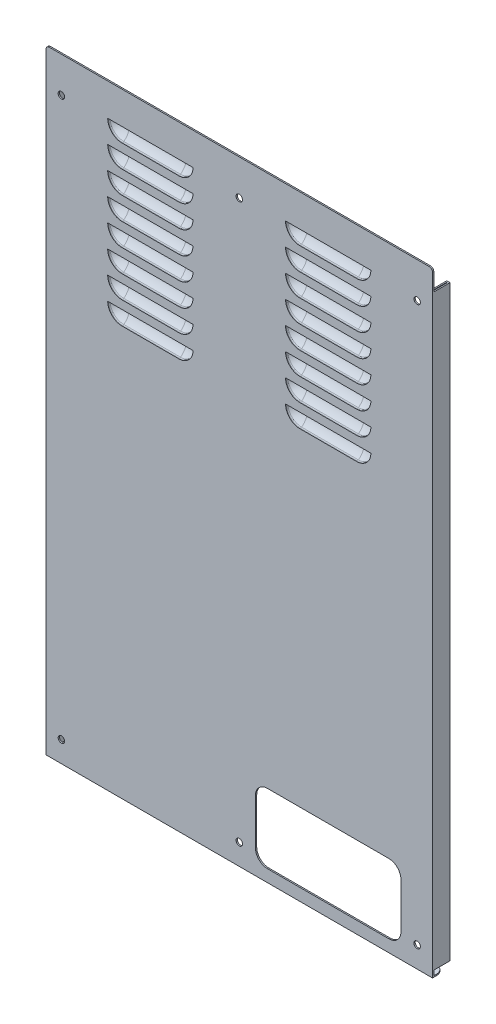
from build123d import *

# Parameters (mm, degrees)
SKETCH1_W              = 303.53
SKETCH1_H              = 482.6
BOSS_EXTRUDE1_DEPTH    = 1.016
FILLET1_R              = 2.54
SKETCH3_W              = 303.53
SKETCH3_H              = 9.525
BOSS_EXTRUDE3_DEPTH    = 1.016
FILLET2_R              = 6.35
CUT_EXTRUDE2_DEPTH     = 5.08
BOSS_EXTRUDE4_DEPTH    = 6.096
FILLET4_R              = 12.3952
SHELL1_START           = 47.544181529
SHELL1_DEPTH           = 44.591316942
SHELL1_2_ANGLE         = 90
SHELL1_3_ANGLE         = 90
CUT_EXTRUDE4_DEPTH     = 6.096
LPATTERN1_COUNT        = 8
LPATTERN1_PITCH        = 17.78
LPATTERN1_COPY_1_DEPTH = 6.096
LPATTERN1_COPY_2_DEPTH = 6.096
LPATTERN1_COPY_3_DEPTH = 6.096
LPATTERN1_COPY_4_DEPTH = 6.096
LPATTERN1_COPY_5_DEPTH = 6.096
LPATTERN1_COPY_6_DEPTH = 6.096
LPATTERN1_COPY_7_DEPTH = 6.096
LPATTERN2_COUNT        = 8
LPATTERN2_PITCH        = 17.78
FILLET5_R              = 1.524
SKETCH11_W             = 12.7
SKETCH11_H             = 461.264
BOSS_EXTRUDE5_DEPTH    = 1.016
SKETCH12_W             = 12.7
SKETCH12_H             = 461.264
BOSS_EXTRUDE6_DEPTH    = 1.016
SKETCH13_R             = 2.54
CUT_EXTRUDE5_DEPTH     = 2.54
SKETCH15_W             = 1.016
SKETCH15_H             = 461.264
BOSS_EXTRUDE7_DEPTH    = 1.524
SKETCH16_W             = 1.016
SKETCH16_H             = 461.264
BOSS_EXTRUDE8_DEPTH    = 11.303


with BuildPart() as part:
    # Sketch1 → Boss-Extrude1 (new body)
    with BuildSketch(Plane.XY):
        Rectangle(SKETCH1_W, SKETCH1_H)
    extrude(amount=BOSS_EXTRUDE1_DEPTH)

    # Fillet1
    fillet1_edges = [part.edges().sort_by_distance(p)[0] for p in [
        (-151.765, 241.3, 0.508),
        (151.765, 241.3, 0.508),
    ]]
    fillet(fillet1_edges, radius=FILLET1_R)

    # Sketch3 → Boss-Extrude3 (add)
    with BuildSketch(Plane.XZ.offset(241.3)):
        with Locations((0, -3.7465)):
            Rectangle(SKETCH3_W, SKETCH3_H)
    extrude(amount=-BOSS_EXTRUDE3_DEPTH)

    # Fillet2
    fillet2_edges = [part.edges().sort_by_distance(p)[0] for p in [
        (-151.765, -240.792, -8.509),
        (151.765, -240.792, -8.509),
    ]]
    fillet(fillet2_edges, radius=FILLET2_R)

    # Sketch6 → Cut-Extrude2 (cut)
    with BuildSketch(Plane.XY.offset(1.016)):
        with BuildLine():
            Line((22.225, -177.165), (117.45468, -177.165))
            ThreePointArc((117.45468, -177.165), (124.189872091, -179.954807909), (126.97968, -186.69))
            Line((126.97968, -186.69), (126.97968, -222.25))
            ThreePointArc((126.97968, -222.25), (124.189872091, -228.985192091), (117.45468, -231.775))
            Line((117.45468, -231.775), (22.225, -231.775))
            ThreePointArc((22.225, -231.775), (15.489807909, -228.985192091), (12.7, -222.25))
            Line((12.7, -222.25), (12.7, -186.69))
            ThreePointArc((12.7, -186.69), (15.489807909, -179.954807909), (22.225, -177.165))
        make_face()
    extrude(amount=-CUT_EXTRUDE2_DEPTH, mode=Mode.SUBTRACT)

    # Sketch10 → Cut-Extrude4 (cut)
    with BuildSketch(Plane(origin=(0, 0, 0), x_dir=(-1, 0, 0), z_dir=(0, 0, -1))):
        with BuildLine():
            Line((-47.544181529, 204.692349549), (-92.135498471, 204.692349549))
            ThreePointArc((-92.135498471, 204.692349549), (-100.060504106, 207.974994365), (-103.343148922, 215.9))
            Line((-103.343148922, 215.9), (-36.336531078, 215.9))
            ThreePointArc((-36.336531078, 215.9), (-39.619175894, 207.974994365), (-47.544181529, 204.692349549))
        make_face()
    cut_extrude4 = extrude(amount=-CUT_EXTRUDE4_DEPTH, mode=Mode.SUBTRACT)

    # Mirror3: Cut-Extrude4 across plane
    add(cut_extrude4.mirror(Plane(origin=(0, 0, 0), x_dir=(0, 0, 1), z_dir=(1, 0, 0))), mode=Mode.SUBTRACT)

    # LPattern1: Cut-Extrude4 ×8
    with Locations(*[(0, -i * LPATTERN1_PITCH, 0) for i in range(1, LPATTERN1_COUNT)]):
        add(cut_extrude4, mode=Mode.SUBTRACT)

    # LPattern1 copy 1 sketch → LPattern1 copy 1 (cut)
    with BuildSketch(Plane(origin=(0, -17.78, 0), x_dir=(1, 0, 0), z_dir=(0, 0, -1))):
        with BuildLine():
            Line((-47.544181529, -204.692349549), (-92.135498471, -204.692349549))
            ThreePointArc((-92.135498471, -204.692349549), (-100.060504106, -207.974994365), (-103.343148922, -215.9))
            Line((-103.343148922, -215.9), (-36.336531078, -215.9))
            ThreePointArc((-36.336531078, -215.9), (-39.619175894, -207.974994365), (-47.544181529, -204.692349549))
        make_face()
    extrude(amount=-LPATTERN1_COPY_1_DEPTH, mode=Mode.SUBTRACT)

    # LPattern1 copy 2 sketch → LPattern1 copy 2 (cut)
    with BuildSketch(Plane(origin=(0, -35.56, 0), x_dir=(1, 0, 0), z_dir=(0, 0, -1))):
        with BuildLine():
            Line((-47.544181529, -204.692349549), (-92.135498471, -204.692349549))
            ThreePointArc((-92.135498471, -204.692349549), (-100.060504106, -207.974994365), (-103.343148922, -215.9))
            Line((-103.343148922, -215.9), (-36.336531078, -215.9))
            ThreePointArc((-36.336531078, -215.9), (-39.619175894, -207.974994365), (-47.544181529, -204.692349549))
        make_face()
    extrude(amount=-LPATTERN1_COPY_2_DEPTH, mode=Mode.SUBTRACT)

    # LPattern1 copy 3 sketch → LPattern1 copy 3 (cut)
    with BuildSketch(Plane(origin=(0, -53.34, 0), x_dir=(1, 0, 0), z_dir=(0, 0, -1))):
        with BuildLine():
            Line((-47.544181529, -204.692349549), (-92.135498471, -204.692349549))
            ThreePointArc((-92.135498471, -204.692349549), (-100.060504106, -207.974994365), (-103.343148922, -215.9))
            Line((-103.343148922, -215.9), (-36.336531078, -215.9))
            ThreePointArc((-36.336531078, -215.9), (-39.619175894, -207.974994365), (-47.544181529, -204.692349549))
        make_face()
    extrude(amount=-LPATTERN1_COPY_3_DEPTH, mode=Mode.SUBTRACT)

    # LPattern1 copy 4 sketch → LPattern1 copy 4 (cut)
    with BuildSketch(Plane(origin=(0, -71.12, 0), x_dir=(1, 0, 0), z_dir=(0, 0, -1))):
        with BuildLine():
            Line((-47.544181529, -204.692349549), (-92.135498471, -204.692349549))
            ThreePointArc((-92.135498471, -204.692349549), (-100.060504106, -207.974994365), (-103.343148922, -215.9))
            Line((-103.343148922, -215.9), (-36.336531078, -215.9))
            ThreePointArc((-36.336531078, -215.9), (-39.619175894, -207.974994365), (-47.544181529, -204.692349549))
        make_face()
    extrude(amount=-LPATTERN1_COPY_4_DEPTH, mode=Mode.SUBTRACT)

    # LPattern1 copy 5 sketch → LPattern1 copy 5 (cut)
    with BuildSketch(Plane(origin=(0, -88.9, 0), x_dir=(1, 0, 0), z_dir=(0, 0, -1))):
        with BuildLine():
            Line((-47.544181529, -204.692349549), (-92.135498471, -204.692349549))
            ThreePointArc((-92.135498471, -204.692349549), (-100.060504106, -207.974994365), (-103.343148922, -215.9))
            Line((-103.343148922, -215.9), (-36.336531078, -215.9))
            ThreePointArc((-36.336531078, -215.9), (-39.619175894, -207.974994365), (-47.544181529, -204.692349549))
        make_face()
    extrude(amount=-LPATTERN1_COPY_5_DEPTH, mode=Mode.SUBTRACT)

    # LPattern1 copy 6 sketch → LPattern1 copy 6 (cut)
    with BuildSketch(Plane(origin=(0, -106.68, 0), x_dir=(1, 0, 0), z_dir=(0, 0, -1))):
        with BuildLine():
            Line((-47.544181529, -204.692349549), (-92.135498471, -204.692349549))
            ThreePointArc((-92.135498471, -204.692349549), (-100.060504106, -207.974994365), (-103.343148922, -215.9))
            Line((-103.343148922, -215.9), (-36.336531078, -215.9))
            ThreePointArc((-36.336531078, -215.9), (-39.619175894, -207.974994365), (-47.544181529, -204.692349549))
        make_face()
    extrude(amount=-LPATTERN1_COPY_6_DEPTH, mode=Mode.SUBTRACT)

    # LPattern1 copy 7 sketch → LPattern1 copy 7 (cut)
    with BuildSketch(Plane(origin=(0, -124.46, 0), x_dir=(1, 0, 0), z_dir=(0, 0, -1))):
        with BuildLine():
            Line((-47.544181529, -204.692349549), (-92.135498471, -204.692349549))
            ThreePointArc((-92.135498471, -204.692349549), (-100.060504106, -207.974994365), (-103.343148922, -215.9))
            Line((-103.343148922, -215.9), (-36.336531078, -215.9))
            ThreePointArc((-36.336531078, -215.9), (-39.619175894, -207.974994365), (-47.544181529, -204.692349549))
        make_face()
    extrude(amount=-LPATTERN1_COPY_7_DEPTH, mode=Mode.SUBTRACT)


with BuildPart() as body_2:
    # Sketch8 → Boss-Extrude4 (new body)
    with BuildSketch(Plane.XY):
        with BuildLine():
            Line((104.54178648, 215.9), (35.13789352, 215.9))
            ThreePointArc((35.13789352, 215.9), (38.771611149, 207.127429619), (47.544181529, 203.493711991))
            Line((47.544181529, 203.493711991), (92.135498471, 203.493711991))
            ThreePointArc((92.135498471, 203.493711991), (100.908068851, 207.127429619), (104.54178648, 215.9))
        make_face()
    extrude(amount=-BOSS_EXTRUDE4_DEPTH)

    # Fillet4
    # the kernel refuses this fillet: 12.3952 mm, written as the material it takes off along each edge
    with BuildSketch(Plane(origin=(92.135498471, 215.9, -6.096), x_dir=(0, -1, 0), z_dir=(-1, 0, 0))) as fillet4_piece_1:
        with BuildLine():
            CenterArc((1.731033333, 12.3952), FILLET4_R, 270, 59.456211265)
            Line((1.731033333, 0), (1.731033333, -0.247904))
            Line((1.731033333, -0.247904), (12.406288009, -0.247904))
            Line((12.406288009, -0.247904), (12.654192009, 0))
            ThreePointArc((12.654192009, 0), (12.654192009, 3.048), (12.619793103, 5.970016))
            Line((12.619793103, 5.970016), (12.406288009, 6.096))
        make_face()
    revolve(axis=Axis((92.135498471, 215.9, -6.096), (0, 0, 1)), revolution_arc=213.302945516, mode=Mode.SUBTRACT)
    with BuildSketch(Plane(origin=(47.544181529, 203.493711991, -6.096), x_dir=(0, 0, 1), z_dir=(1, 0, 0))) as fillet4_piece_2:
        with BuildLine():
            CenterArc((12.3952, -10.675254676), FILLET4_R, 120.543788735, 59.456211265)
            Line((0, -10.675254676), (-0.247904, -10.675254676))
            Line((-0.247904, -10.675254676), (-0.247904, 0))
            Line((-0.247904, 0), (0, 0.247904))
            ThreePointArc((0, 0.247904), (3.048, 0.247904), (5.970016, 0.213505094))
            Line((5.970016, 0.213505094), (6.096, 0))
        make_face()
    extrude(amount=44.591316941, mode=Mode.SUBTRACT)
    with BuildSketch(Plane(origin=(47.544181529, 215.9, -6.096), x_dir=(0.5490657852484508, 0.8357791355791925, 0), z_dir=(0.8357791355791925, -0.5490657852484508, 0))) as fillet4_piece_3:
        with BuildLine():
            CenterArc((1.731033333, 12.3952), FILLET4_R, 270, 59.456211265)
            Line((1.731033333, 0), (1.731033333, -0.247904))
            Line((1.731033333, -0.247904), (12.406288009, -0.247904))
            Line((12.406288009, -0.247904), (12.654192009, 0))
            ThreePointArc((12.654192009, 0), (12.654192009, 3.048), (12.619793103, 5.970016))
            Line((12.619793103, 5.970016), (12.406288009, 6.096))
        make_face()
    revolve(axis=Axis((47.544181529, 215.9, -6.096), (0, 0, 1)), revolution_arc=213.302945516, mode=Mode.SUBTRACT)

    # Shell1: read off the stored shape, not the designer's step
    # Shell1 outline → Shell1 (cut)
    with BuildSketch(Plane.YZ.offset(SHELL1_START)):
        with BuildLine():
            Line((214.168966667, -5.08), (215.9, -5.08))
            Line((215.9, -5.08), (215.9, 0))
            Line((215.9, 0), (204.692349549, 0))
            ThreePointArc((204.692349549, 0), (208.792800003, -3.729908866), (214.168966667, -5.08))
        make_face()
    extrude(amount=SHELL1_DEPTH, mode=Mode.SUBTRACT)

    # Shell1 2 outline → Shell1 2 (revolve, cut)
    with BuildSketch(Plane(origin=(47.544181529, 215.9, 0), x_dir=(-1, 0, 0), z_dir=(0, 1, 0))):
        with BuildLine():
            ThreePointArc((1.731033333, -5.08), (7.107199997, -3.729908866), (11.207650451, 0))
            Line((11.207650451, 0), (0, 0))
            Line((0, 0), (0, -5.08))
            Line((0, -5.08), (1.731033333, -5.08))
        make_face()
    revolve(axis=Axis((47.544181529, 215.9, 0), (0, 0, 1)), revolution_arc=SHELL1_2_ANGLE, mode=Mode.SUBTRACT)

    # Shell1 3 outline → Shell1 3 (revolve, cut)
    with BuildSketch(Plane(origin=(92.135498471, 215.9, 0), x_dir=(0, -1, 0), z_dir=(-1, 0, 0))):
        with BuildLine():
            ThreePointArc((1.731033333, -5.08), (7.107199997, -3.729908866), (11.207650451, 0))
            Line((11.207650451, 0), (0, 0))
            Line((0, 0), (0, -5.08))
            Line((0, -5.08), (1.731033333, -5.08))
        make_face()
    revolve(axis=Axis((92.135498471, 215.9, 0), (0, 0, 1)), revolution_arc=SHELL1_3_ANGLE, mode=Mode.SUBTRACT)


with BuildPart() as lpattern2_1:
    # LPattern2: pattern copy
    add(body_2.part.moved(Location(Vector(0, -1, 0) * (1 * LPATTERN2_PITCH))))


with BuildPart() as lpattern2_2:
    # LPattern2: pattern copy
    add(body_2.part.moved(Location(Vector(0, -1, 0) * (2 * LPATTERN2_PITCH))))


with BuildPart() as lpattern2_3:
    # LPattern2: pattern copy
    add(body_2.part.moved(Location(Vector(0, -1, 0) * (3 * LPATTERN2_PITCH))))


with BuildPart() as lpattern2_4:
    # LPattern2: pattern copy
    add(body_2.part.moved(Location(Vector(0, -1, 0) * (4 * LPATTERN2_PITCH))))


with BuildPart() as lpattern2_5:
    # LPattern2: pattern copy
    add(body_2.part.moved(Location(Vector(0, -1, 0) * (5 * LPATTERN2_PITCH))))


with BuildPart() as lpattern2_6:
    # LPattern2: pattern copy
    add(body_2.part.moved(Location(Vector(0, -1, 0) * (6 * LPATTERN2_PITCH))))


with BuildPart() as lpattern2_7:
    # LPattern2: pattern copy
    add(body_2.part.moved(Location(Vector(0, -1, 0) * (7 * LPATTERN2_PITCH))))


with BuildPart() as body_10:
    # Mirror4: mirrored copy
    add(body_2.part.mirror(Plane(origin=(0, 0, 0), x_dir=(0, 0, 1), z_dir=(1, 0, 0))))


with BuildPart() as body_11:
    # Mirror4 2: mirrored copy
    add(lpattern2_1.part.mirror(Plane(origin=(0, 0, 0), x_dir=(0, 0, 1), z_dir=(1, 0, 0))))


with BuildPart() as body_12:
    # Mirror4 3: mirrored copy
    add(lpattern2_2.part.mirror(Plane(origin=(0, 0, 0), x_dir=(0, 0, 1), z_dir=(1, 0, 0))))


with BuildPart() as body_13:
    # Mirror4 4: mirrored copy
    add(lpattern2_3.part.mirror(Plane(origin=(0, 0, 0), x_dir=(0, 0, 1), z_dir=(1, 0, 0))))


with BuildPart() as body_14:
    # Mirror4 5: mirrored copy
    add(lpattern2_4.part.mirror(Plane(origin=(0, 0, 0), x_dir=(0, 0, 1), z_dir=(1, 0, 0))))


with BuildPart() as body_15:
    # Mirror4 6: mirrored copy
    add(lpattern2_5.part.mirror(Plane(origin=(0, 0, 0), x_dir=(0, 0, 1), z_dir=(1, 0, 0))))


with BuildPart() as body_16:
    # Mirror4 7: mirrored copy
    add(lpattern2_6.part.mirror(Plane(origin=(0, 0, 0), x_dir=(0, 0, 1), z_dir=(1, 0, 0))))


with BuildPart() as body_17:
    # Mirror4 8: mirrored copy
    add(lpattern2_7.part.mirror(Plane(origin=(0, 0, 0), x_dir=(0, 0, 1), z_dir=(1, 0, 0))))


with BuildPart() as body_2_1:
    add(body_2.part)

    # Combine1: union LPattern2_1, LPattern2_2, body 12, body 11, body 10, part, body 13, body 14, body 15, body 16, body 17, LPattern2_3, LPattern2_4, LPattern2_5, LPattern2_6, LPattern2_7
    add(lpattern2_1.part)
    add(lpattern2_2.part)
    add(body_12.part)
    add(body_11.part)
    add(body_10.part)
    add(part.part)
    add(body_13.part)
    add(body_14.part)
    add(body_15.part)
    add(body_16.part)
    add(body_17.part)
    add(lpattern2_3.part)
    add(lpattern2_4.part)
    add(lpattern2_5.part)
    add(lpattern2_6.part)
    add(lpattern2_7.part)

    # Fillet5
    # the kernel refuses this fillet: 1.524 mm, written as the material it adds along each edge
    with BuildSketch(Plane(origin=(47.544181529, 198.12, 0), x_dir=(-1, 0, 0), z_dir=(0, 1, 0))) as fillet5_piece_1:
        with BuildLine():
            CenterArc((9.683650451, 0.47847427), FILLET5_R, 323.798640109, 36.201359891)
            Line((11.207650451, 0.47847427), (11.207650451, 0))
            ThreePointArc((11.207650451, 0), (11.062925162, -0.212480854), (10.913436603, -0.421637956))
        make_face()
    revolve(axis=Axis((47.544181529, 198.12, 0), (0, 0, 1)), revolution_arc=90)
    with BuildSketch(Plane(origin=(47.544181529, 186.912349549, 0), x_dir=(0, 2.910634590047968e-10, 1.0), z_dir=(1, 0, 0)), Plane(origin=(47.544181529, 169.132349549, 0), x_dir=(0, 2.910634590048047e-10, 1.0), z_dir=(1, 0, 0))) as fillet5_piece_2:
        with BuildLine():
            CenterArc((0.478474271, -1.524), FILLET5_R, 90.000000017, 36.201359889)
            ThreePointArc((-0.421637956, -0.294213848), (-0.212480854, -0.144725289), (0, 0))
            Line((0, 0), (0.47847427, 0))
        make_face()
    extrude(amount=44.591316942)
    with BuildSketch(Plane(origin=(92.135498471, 198.12, 0), x_dir=(0, -1, 0), z_dir=(-1, 0, 0))) as fillet5_piece_3:
        with BuildLine():
            CenterArc((9.683650451, 0.47847427), FILLET5_R, 323.798640109, 36.201359891)
            Line((11.207650451, 0.47847427), (11.207650451, 0))
            ThreePointArc((11.207650451, 0), (11.062925162, -0.212480854), (10.913436603, -0.421637956))
        make_face()
    revolve(axis=Axis((92.135498471, 198.12, 0), (0, 0, 1)), revolution_arc=90)
    with BuildSketch(Plane(origin=(47.544181529, 180.34, 0), x_dir=(-1, 0, 0), z_dir=(0, 1, 0))) as fillet5_piece_4:
        with BuildLine():
            CenterArc((9.683650451, 0.47847427), FILLET5_R, 323.798640109, 36.201359891)
            Line((11.207650451, 0.47847427), (11.207650451, 0))
            ThreePointArc((11.207650451, 0), (11.062925162, -0.212480854), (10.913436603, -0.421637956))
        make_face()
    revolve(axis=Axis((47.544181529, 180.34, 0), (0, 0, 1)), revolution_arc=90)
    with BuildSketch(Plane(origin=(92.135498471, 180.34, 0), x_dir=(0, -1, 0), z_dir=(-1, 0, 0))) as fillet5_piece_5:
        with BuildLine():
            CenterArc((9.683650451, 0.47847427), FILLET5_R, 323.798640109, 36.201359891)
            Line((11.207650451, 0.47847427), (11.207650451, 0))
            ThreePointArc((11.207650451, 0), (11.062925162, -0.212480854), (10.913436603, -0.421637956))
        make_face()
    revolve(axis=Axis((92.135498471, 180.34, 0), (0, 0, 1)), revolution_arc=90)
    with BuildSketch(Plane(origin=(47.544181529, 215.9, 0), x_dir=(-1, 0, 0), z_dir=(0, 1, 0))) as fillet5_piece_6:
        with BuildLine():
            CenterArc((9.683650451, 0.47847427), FILLET5_R, 323.798640109, 36.201359891)
            Line((11.207650451, 0.47847427), (11.207650451, 0))
            ThreePointArc((11.207650451, 0), (11.062925162, -0.212480854), (10.913436603, -0.421637956))
        make_face()
    revolve(axis=Axis((47.544181529, 215.9, 0), (0, 0, 1)), revolution_arc=90)
    with BuildSketch(Plane(origin=(47.544181529, 204.692349549, 0), x_dir=(0, 0.5722441694438087, -0.8200832948777615), z_dir=(1, 0, 0))) as fillet5_piece_7:
        with BuildLine():
            CenterArc((0.479711358, 1.523611053), FILLET5_R, 235.093132758, 36.201359889)
            Line((-0.392388756, 0.273804112), (0, 0))
            ThreePointArc((0, 0), (0.257070201, -0.002904137), (0.514140403, 0))
        make_face()
    extrude(amount=44.591316942)
    with BuildSketch(Plane(origin=(92.135498471, 215.9, 0), x_dir=(0, -1, 0), z_dir=(-1, 0, 0))) as fillet5_piece_8:
        with BuildLine():
            CenterArc((9.683650451, 0.47847427), FILLET5_R, 323.798640109, 36.201359891)
            Line((11.207650451, 0.47847427), (11.207650451, 0))
            ThreePointArc((11.207650451, 0), (11.062925162, -0.212480854), (10.913436603, -0.421637956))
        make_face()
    revolve(axis=Axis((92.135498471, 215.9, 0), (0, 0, 1)), revolution_arc=90)
    with BuildSketch(Plane(origin=(-47.544181529, 215.9, 0), x_dir=(1, 0, 0), z_dir=(0, 1, 0))) as fillet5_piece_9:
        with BuildLine():
            CenterArc((9.683650451, -0.47847427), FILLET5_R, 0, 36.201359891)
            ThreePointArc((10.913436603, 0.421637956), (11.062925162, 0.212480854), (11.207650451, 0))
            Line((11.207650451, 0), (11.207650451, -0.47847427))
        make_face()
    revolve(axis=Axis((-47.544181529, 215.9, 0), (0, 0, -1)), revolution_arc=90)
    with BuildSketch(Plane(origin=(-92.135498471, 215.9, 0), x_dir=(0, -1, 0), z_dir=(1, 0, 0))) as fillet5_piece_10:
        with BuildLine():
            CenterArc((9.683650451, -0.47847427), FILLET5_R, 0, 36.201359891)
            ThreePointArc((10.913436603, 0.421637956), (11.062925162, 0.212480854), (11.207650451, 0))
            Line((11.207650451, 0), (11.207650451, -0.47847427))
        make_face()
    revolve(axis=Axis((-92.135498471, 215.9, 0), (0, 0, -1)), revolution_arc=90)
    with BuildSketch(Plane(origin=(-47.544181529, 204.692349549, 0), x_dir=(0, 2.910634590047968e-10, 1.0), z_dir=(-1, 0, 0)), Plane(origin=(-47.544181529, 186.912349549, 0), x_dir=(0, 2.910634590047968e-10, 1.0), z_dir=(-1, 0, 0)), Plane(origin=(-47.544181529, 169.132349549, 0), x_dir=(0, 2.910634590048047e-10, 1.0), z_dir=(-1, 0, 0))) as fillet5_piece_11:
        with BuildLine():
            CenterArc((0.478474271, 1.524), FILLET5_R, 233.798640094, 36.201359889)
            ThreePointArc((-0.421637956, 0.294213848), (-0.212480854, 0.144725289), (0, 0))
            Line((0, 0), (0.47847427, 0))
        make_face()
    extrude(amount=44.591316942)
    with BuildSketch(Plane(origin=(47.544181529, 162.56, 0), x_dir=(-1, 0, 0), z_dir=(0, 1, 0))) as fillet5_piece_12:
        with BuildLine():
            CenterArc((9.683650451, 0.47847427), FILLET5_R, 323.798640109, 36.201359891)
            Line((11.207650451, 0.47847427), (11.207650451, 0))
            ThreePointArc((11.207650451, 0), (11.062925162, -0.212480854), (10.913436603, -0.421637956))
        make_face()
    revolve(axis=Axis((47.544181529, 162.56, 0), (0, 0, 1)), revolution_arc=90)
    with BuildSketch(Plane(origin=(47.544181529, 151.352349549, 0), x_dir=(0, 0, 1), z_dir=(1, 0, 0)), Plane(origin=(47.544181529, 133.572349549, 0), x_dir=(0, 0, 1), z_dir=(1, 0, 0)), Plane(origin=(47.544181529, 115.792349549, 0), x_dir=(0, 0, 1), z_dir=(1, 0, 0)), Plane(origin=(47.544181529, 98.012349549, 0), x_dir=(0, 0, 1), z_dir=(1, 0, 0)), Plane(origin=(47.544181529, 80.232349549, 0), x_dir=(0, 0, 1), z_dir=(1, 0, 0))) as fillet5_piece_13:
        with BuildLine():
            CenterArc((0.47847427, -1.524), FILLET5_R, 90, 36.201359889)
            ThreePointArc((-0.421637956, -0.294213848), (-0.212480854, -0.144725289), (0, 0))
            Line((0, 0), (0.47847427, 0))
        make_face()
    extrude(amount=44.591316941)
    with BuildSketch(Plane(origin=(92.135498471, 162.56, 0), x_dir=(0, -1, 0), z_dir=(-1, 0, 0))) as fillet5_piece_14:
        with BuildLine():
            CenterArc((9.683650451, 0.47847427), FILLET5_R, 323.798640109, 36.201359891)
            Line((11.207650451, 0.47847427), (11.207650451, 0))
            ThreePointArc((11.207650451, 0), (11.062925162, -0.212480854), (10.913436603, -0.421637956))
        make_face()
    revolve(axis=Axis((92.135498471, 162.56, 0), (0, 0, 1)), revolution_arc=90)
    with BuildSketch(Plane(origin=(47.544181529, 144.78, 0), x_dir=(-1, 0, 0), z_dir=(0, 1, 0))) as fillet5_piece_15:
        with BuildLine():
            CenterArc((9.683650451, 0.47847427), FILLET5_R, 323.798640109, 36.201359891)
            Line((11.207650451, 0.47847427), (11.207650451, 0))
            ThreePointArc((11.207650451, 0), (11.062925162, -0.212480854), (10.913436603, -0.421637956))
        make_face()
    revolve(axis=Axis((47.544181529, 144.78, 0), (0, 0, 1)), revolution_arc=90)
    with BuildSketch(Plane(origin=(92.135498471, 144.78, 0), x_dir=(0, -1, 0), z_dir=(-1, 0, 0))) as fillet5_piece_16:
        with BuildLine():
            CenterArc((9.683650451, 0.47847427), FILLET5_R, 323.798640109, 36.201359891)
            Line((11.207650451, 0.47847427), (11.207650451, 0))
            ThreePointArc((11.207650451, 0), (11.062925162, -0.212480854), (10.913436603, -0.421637956))
        make_face()
    revolve(axis=Axis((92.135498471, 144.78, 0), (0, 0, 1)), revolution_arc=90)
    with BuildSketch(Plane(origin=(47.544181529, 127, 0), x_dir=(-1, 0, 0), z_dir=(0, 1, 0))) as fillet5_piece_17:
        with BuildLine():
            CenterArc((9.683650451, 0.47847427), FILLET5_R, 323.798640109, 36.201359891)
            Line((11.207650451, 0.47847427), (11.207650451, 0))
            ThreePointArc((11.207650451, 0), (11.062925162, -0.212480854), (10.913436603, -0.421637956))
        make_face()
    revolve(axis=Axis((47.544181529, 127, 0), (0, 0, 1)), revolution_arc=90)
    with BuildSketch(Plane(origin=(92.135498471, 127, 0), x_dir=(0, -1, 0), z_dir=(-1, 0, 0))) as fillet5_piece_18:
        with BuildLine():
            CenterArc((9.683650451, 0.47847427), FILLET5_R, 323.798640109, 36.201359891)
            Line((11.207650451, 0.47847427), (11.207650451, 0))
            ThreePointArc((11.207650451, 0), (11.062925162, -0.212480854), (10.913436603, -0.421637956))
        make_face()
    revolve(axis=Axis((92.135498471, 127, 0), (0, 0, 1)), revolution_arc=90)
    with BuildSketch(Plane(origin=(47.544181529, 109.22, 0), x_dir=(-1, 0, 0), z_dir=(0, 1, 0))) as fillet5_piece_19:
        with BuildLine():
            CenterArc((9.683650451, 0.47847427), FILLET5_R, 323.798640109, 36.201359891)
            Line((11.207650451, 0.47847427), (11.207650451, 0))
            ThreePointArc((11.207650451, 0), (11.062925162, -0.212480854), (10.913436603, -0.421637956))
        make_face()
    revolve(axis=Axis((47.544181529, 109.22, 0), (0, 0, 1)), revolution_arc=90)
    with BuildSketch(Plane(origin=(92.135498471, 109.22, 0), x_dir=(0, -1, 0), z_dir=(-1, 0, 0))) as fillet5_piece_20:
        with BuildLine():
            CenterArc((9.683650451, 0.47847427), FILLET5_R, 323.798640109, 36.201359891)
            Line((11.207650451, 0.47847427), (11.207650451, 0))
            ThreePointArc((11.207650451, 0), (11.062925162, -0.212480854), (10.913436603, -0.421637956))
        make_face()
    revolve(axis=Axis((92.135498471, 109.22, 0), (0, 0, 1)), revolution_arc=90)
    with BuildSketch(Plane(origin=(47.544181529, 91.44, 0), x_dir=(-1, 0, 0), z_dir=(0, 1, 0))) as fillet5_piece_21:
        with BuildLine():
            CenterArc((9.683650451, 0.47847427), FILLET5_R, 323.798640109, 36.201359891)
            Line((11.207650451, 0.47847427), (11.207650451, 0))
            ThreePointArc((11.207650451, 0), (11.062925162, -0.212480854), (10.913436603, -0.421637956))
        make_face()
    revolve(axis=Axis((47.544181529, 91.44, 0), (0, 0, 1)), revolution_arc=90)
    with BuildSketch(Plane(origin=(92.135498471, 91.44, 0), x_dir=(0, -1, 0), z_dir=(-1, 0, 0))) as fillet5_piece_22:
        with BuildLine():
            CenterArc((9.683650451, 0.47847427), FILLET5_R, 323.798640109, 36.201359891)
            Line((11.207650451, 0.47847427), (11.207650451, 0))
            ThreePointArc((11.207650451, 0), (11.062925162, -0.212480854), (10.913436603, -0.421637956))
        make_face()
    revolve(axis=Axis((92.135498471, 91.44, 0), (0, 0, 1)), revolution_arc=90)
    with BuildSketch(Plane(origin=(-47.544181529, 198.12, 0), x_dir=(1, 0, 0), z_dir=(0, 1, 0))) as fillet5_piece_23:
        with BuildLine():
            CenterArc((9.683650451, -0.47847427), FILLET5_R, 0, 36.201359891)
            ThreePointArc((10.913436603, 0.421637956), (11.062925162, 0.212480854), (11.207650451, 0))
            Line((11.207650451, 0), (11.207650451, -0.47847427))
        make_face()
    revolve(axis=Axis((-47.544181529, 198.12, 0), (0, 0, -1)), revolution_arc=90)
    with BuildSketch(Plane(origin=(-92.135498471, 198.12, 0), x_dir=(0, -1, 0), z_dir=(1, 0, 0))) as fillet5_piece_24:
        with BuildLine():
            CenterArc((9.683650451, -0.47847427), FILLET5_R, 0, 36.201359891)
            ThreePointArc((10.913436603, 0.421637956), (11.062925162, 0.212480854), (11.207650451, 0))
            Line((11.207650451, 0), (11.207650451, -0.47847427))
        make_face()
    revolve(axis=Axis((-92.135498471, 198.12, 0), (0, 0, -1)), revolution_arc=90)
    with BuildSketch(Plane(origin=(-47.544181529, 180.34, 0), x_dir=(1, 0, 0), z_dir=(0, 1, 0))) as fillet5_piece_25:
        with BuildLine():
            CenterArc((9.683650451, -0.47847427), FILLET5_R, 0, 36.201359891)
            ThreePointArc((10.913436603, 0.421637956), (11.062925162, 0.212480854), (11.207650451, 0))
            Line((11.207650451, 0), (11.207650451, -0.47847427))
        make_face()
    revolve(axis=Axis((-47.544181529, 180.34, 0), (0, 0, -1)), revolution_arc=90)
    with BuildSketch(Plane(origin=(-92.135498471, 180.34, 0), x_dir=(0, -1, 0), z_dir=(1, 0, 0))) as fillet5_piece_26:
        with BuildLine():
            CenterArc((9.683650451, -0.47847427), FILLET5_R, 0, 36.201359891)
            ThreePointArc((10.913436603, 0.421637956), (11.062925162, 0.212480854), (11.207650451, 0))
            Line((11.207650451, 0), (11.207650451, -0.47847427))
        make_face()
    revolve(axis=Axis((-92.135498471, 180.34, 0), (0, 0, -1)), revolution_arc=90)
    with BuildSketch(Plane(origin=(-47.544181529, 162.56, 0), x_dir=(1, 0, 0), z_dir=(0, 1, 0))) as fillet5_piece_27:
        with BuildLine():
            CenterArc((9.683650451, -0.47847427), FILLET5_R, 0, 36.201359891)
            ThreePointArc((10.913436603, 0.421637956), (11.062925162, 0.212480854), (11.207650451, 0))
            Line((11.207650451, 0), (11.207650451, -0.47847427))
        make_face()
    revolve(axis=Axis((-47.544181529, 162.56, 0), (0, 0, -1)), revolution_arc=90)
    with BuildSketch(Plane(origin=(-47.544181529, 151.352349549, 0), x_dir=(0, 0, 1), z_dir=(-1, 0, 0)), Plane(origin=(-47.544181529, 133.572349549, 0), x_dir=(0, 0, 1), z_dir=(-1, 0, 0)), Plane(origin=(-47.544181529, 115.792349549, 0), x_dir=(0, 0, 1), z_dir=(-1, 0, 0)), Plane(origin=(-47.544181529, 98.012349549, 0), x_dir=(0, 0, 1), z_dir=(-1, 0, 0)), Plane(origin=(-47.544181529, 80.232349549, 0), x_dir=(0, 0, 1), z_dir=(-1, 0, 0))) as fillet5_piece_28:
        with BuildLine():
            CenterArc((0.47847427, 1.524), FILLET5_R, 233.798640111, 36.201359889)
            ThreePointArc((-0.421637956, 0.294213848), (-0.212480854, 0.144725289), (0, 0))
            Line((0, 0), (0.47847427, 0))
        make_face()
    extrude(amount=44.591316941)
    with BuildSketch(Plane(origin=(-92.135498471, 162.56, 0), x_dir=(0, -1, 0), z_dir=(1, 0, 0))) as fillet5_piece_29:
        with BuildLine():
            CenterArc((9.683650451, -0.47847427), FILLET5_R, 0, 36.201359891)
            ThreePointArc((10.913436603, 0.421637956), (11.062925162, 0.212480854), (11.207650451, 0))
            Line((11.207650451, 0), (11.207650451, -0.47847427))
        make_face()
    revolve(axis=Axis((-92.135498471, 162.56, 0), (0, 0, -1)), revolution_arc=90)
    with BuildSketch(Plane(origin=(-47.544181529, 144.78, 0), x_dir=(1, 0, 0), z_dir=(0, 1, 0))) as fillet5_piece_30:
        with BuildLine():
            CenterArc((9.683650451, -0.47847427), FILLET5_R, 0, 36.201359891)
            ThreePointArc((10.913436603, 0.421637956), (11.062925162, 0.212480854), (11.207650451, 0))
            Line((11.207650451, 0), (11.207650451, -0.47847427))
        make_face()
    revolve(axis=Axis((-47.544181529, 144.78, 0), (0, 0, -1)), revolution_arc=90)
    with BuildSketch(Plane(origin=(-92.135498471, 144.78, 0), x_dir=(0, -1, 0), z_dir=(1, 0, 0))) as fillet5_piece_31:
        with BuildLine():
            CenterArc((9.683650451, -0.47847427), FILLET5_R, 0, 36.201359891)
            ThreePointArc((10.913436603, 0.421637956), (11.062925162, 0.212480854), (11.207650451, 0))
            Line((11.207650451, 0), (11.207650451, -0.47847427))
        make_face()
    revolve(axis=Axis((-92.135498471, 144.78, 0), (0, 0, -1)), revolution_arc=90)
    with BuildSketch(Plane(origin=(-47.544181529, 127, 0), x_dir=(1, 0, 0), z_dir=(0, 1, 0))) as fillet5_piece_32:
        with BuildLine():
            CenterArc((9.683650451, -0.47847427), FILLET5_R, 0, 36.201359891)
            ThreePointArc((10.913436603, 0.421637956), (11.062925162, 0.212480854), (11.207650451, 0))
            Line((11.207650451, 0), (11.207650451, -0.47847427))
        make_face()
    revolve(axis=Axis((-47.544181529, 127, 0), (0, 0, -1)), revolution_arc=90)
    with BuildSketch(Plane(origin=(-92.135498471, 127, 0), x_dir=(0, -1, 0), z_dir=(1, 0, 0))) as fillet5_piece_33:
        with BuildLine():
            CenterArc((9.683650451, -0.47847427), FILLET5_R, 0, 36.201359891)
            ThreePointArc((10.913436603, 0.421637956), (11.062925162, 0.212480854), (11.207650451, 0))
            Line((11.207650451, 0), (11.207650451, -0.47847427))
        make_face()
    revolve(axis=Axis((-92.135498471, 127, 0), (0, 0, -1)), revolution_arc=90)
    with BuildSketch(Plane(origin=(-47.544181529, 109.22, 0), x_dir=(1, 0, 0), z_dir=(0, 1, 0))) as fillet5_piece_34:
        with BuildLine():
            CenterArc((9.683650451, -0.47847427), FILLET5_R, 0, 36.201359891)
            ThreePointArc((10.913436603, 0.421637956), (11.062925162, 0.212480854), (11.207650451, 0))
            Line((11.207650451, 0), (11.207650451, -0.47847427))
        make_face()
    revolve(axis=Axis((-47.544181529, 109.22, 0), (0, 0, -1)), revolution_arc=90)
    with BuildSketch(Plane(origin=(-92.135498471, 109.22, 0), x_dir=(0, -1, 0), z_dir=(1, 0, 0))) as fillet5_piece_35:
        with BuildLine():
            CenterArc((9.683650451, -0.47847427), FILLET5_R, 0, 36.201359891)
            ThreePointArc((10.913436603, 0.421637956), (11.062925162, 0.212480854), (11.207650451, 0))
            Line((11.207650451, 0), (11.207650451, -0.47847427))
        make_face()
    revolve(axis=Axis((-92.135498471, 109.22, 0), (0, 0, -1)), revolution_arc=90)
    with BuildSketch(Plane(origin=(-47.544181529, 91.44, 0), x_dir=(1, 0, 0), z_dir=(0, 1, 0))) as fillet5_piece_36:
        with BuildLine():
            CenterArc((9.683650451, -0.47847427), FILLET5_R, 0, 36.201359891)
            ThreePointArc((10.913436603, 0.421637956), (11.062925162, 0.212480854), (11.207650451, 0))
            Line((11.207650451, 0), (11.207650451, -0.47847427))
        make_face()
    revolve(axis=Axis((-47.544181529, 91.44, 0), (0, 0, -1)), revolution_arc=90)
    with BuildSketch(Plane(origin=(-92.135498471, 91.44, 0), x_dir=(0, -1, 0), z_dir=(1, 0, 0))) as fillet5_piece_37:
        with BuildLine():
            CenterArc((9.683650451, -0.47847427), FILLET5_R, 0, 36.201359891)
            ThreePointArc((10.913436603, 0.421637956), (11.062925162, 0.212480854), (11.207650451, 0))
            Line((11.207650451, 0), (11.207650451, -0.47847427))
        make_face()
    revolve(axis=Axis((-92.135498471, 91.44, 0), (0, 0, -1)), revolution_arc=90)

    # Sketch11 → Boss-Extrude5 (add)
    with BuildSketch(Plane(origin=(151.765, 0, 0), x_dir=(0, 0, -1), z_dir=(1, 0, 0))):
        with Locations((6.35, -5.842)):
            Rectangle(SKETCH11_W, SKETCH11_H)
    extrude(amount=-BOSS_EXTRUDE5_DEPTH)

    # Sketch12 → Boss-Extrude6 (add)
    with BuildSketch(Plane.ZY.offset(151.765)):
        with Locations((-6.35, -5.842)):
            Rectangle(SKETCH12_W, SKETCH12_H)
    extrude(amount=-BOSS_EXTRUDE6_DEPTH)

    # Sketch13 → Cut-Extrude5 (cut)
    with BuildSketch(Plane.XY.offset(1.016)):
        with Locations((-139.7, 213.36)):
            Circle(SKETCH13_R)
        with Locations((0, 213.36)):
            Circle(SKETCH13_R)
        with Locations((139.7, 213.36)):
            Circle(SKETCH13_R)
        with Locations((139.7, -224.79)):
            Circle(SKETCH13_R)
        with Locations((0, -224.79)):
            Circle(SKETCH13_R)
        with Locations((-139.7, -224.79)):
            Circle(SKETCH13_R)
    extrude(amount=-CUT_EXTRUDE5_DEPTH, mode=Mode.SUBTRACT)

    # Sketch15 → Boss-Extrude7 (add)
    with BuildSketch(Plane.ZY.offset(-150.749)):
        with Locations((-12.192, -5.842)):
            Rectangle(SKETCH15_W, SKETCH15_H)
    boss_extrude7 = extrude(amount=BOSS_EXTRUDE7_DEPTH)

    # Sketch16 → Boss-Extrude8 (add)
    with BuildSketch(Plane.XY.offset(-11.684)):
        with Locations((149.733, -5.842)):
            Rectangle(SKETCH16_W, SKETCH16_H)
    boss_extrude8 = extrude(amount=BOSS_EXTRUDE8_DEPTH)

    # Mirror5: Boss-Extrude7, Boss-Extrude8 across plane
    add(boss_extrude7.mirror(Plane(origin=(0, 0, 0), x_dir=(0, 0, 1), z_dir=(1, 0, 0))))
    add(boss_extrude8.mirror(Plane(origin=(0, 0, 0), x_dir=(0, 0, 1), z_dir=(1, 0, 0))))


solid = body_2_1.part
